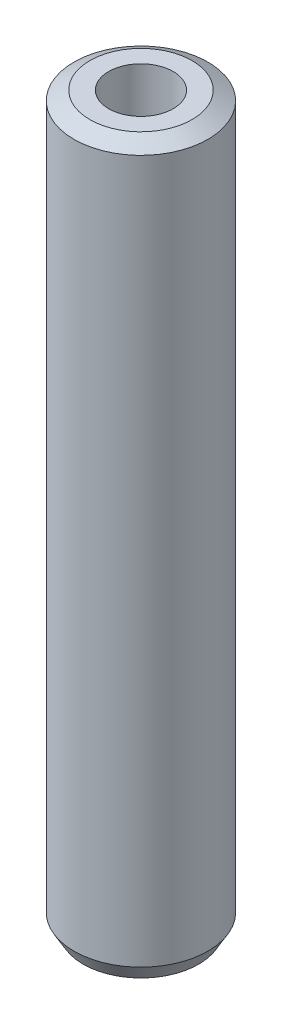
from build123d import *
from OCP.BRepFilletAPI import BRepFilletAPI_MakeChamfer

# Parameters (mm, degrees)
SKETCH1_R           = 35
BOSS_EXTRUDE1_DEPTH = 380.457695247
SKETCH2_R           = 16.86040568
CUT_EXTRUDE1_DEPTH  = 384.663990847
CHAMFER1_SIZE       = 4.788244635
CHAMFER1_SIZE2      = 8.293482987


with BuildPart() as part:
    # Sketch1 → Boss-Extrude1 (new body)
    with BuildSketch(Plane(origin=(0, 0, 0), x_dir=(1, 0, 0), z_dir=(0, 1, 0))):
        Circle(SKETCH1_R)
    extrude(amount=BOSS_EXTRUDE1_DEPTH)

    # Sketch2 → Cut-Extrude1 (cut, through all)
    with BuildSketch(Plane(origin=(0, 0, 0), x_dir=(1, 0, 0), z_dir=(0, 1, 0))):
        Circle(SKETCH2_R)
    extrude(amount=CUT_EXTRUDE1_DEPTH, mode=Mode.SUBTRACT)

    # Chamfer1: one chamfer whose edges measure the first distance from different faces: ONE call of the kernel's chamfer builder (chamfer() names one face for all edges)
    chamfer1_edges_1 = [part.edges().sort_by_distance(p)[0] for p in [
        (-35, 380.457695247, 0),
    ]]
    chamfer1_side_1 = [part.faces().sort_by_distance(p)[0] for p in [
        (-35, 190.228847623, 0),
    ]]
    chamfer1_edges_2 = [part.edges().sort_by_distance(p)[0] for p in [
        (-35, 0, 0),
    ]]
    chamfer1_side_2 = [part.faces().sort_by_distance(p)[0] for p in [
        (-34.010050506, 0, 0),
    ]]
    chamfer1 = BRepFilletAPI_MakeChamfer(part.part.solid().wrapped)
    for e in chamfer1_edges_1:
        chamfer1.Add(CHAMFER1_SIZE, CHAMFER1_SIZE2, e.wrapped, chamfer1_side_1[0].wrapped)  # the first distance lies on this face
    for e in chamfer1_edges_2:
        chamfer1.Add(CHAMFER1_SIZE, CHAMFER1_SIZE2, e.wrapped, chamfer1_side_2[0].wrapped)  # the first distance lies on this face
    add(Compound.cast(chamfer1.Shape()), mode=Mode.REPLACE)


solid = part.part
